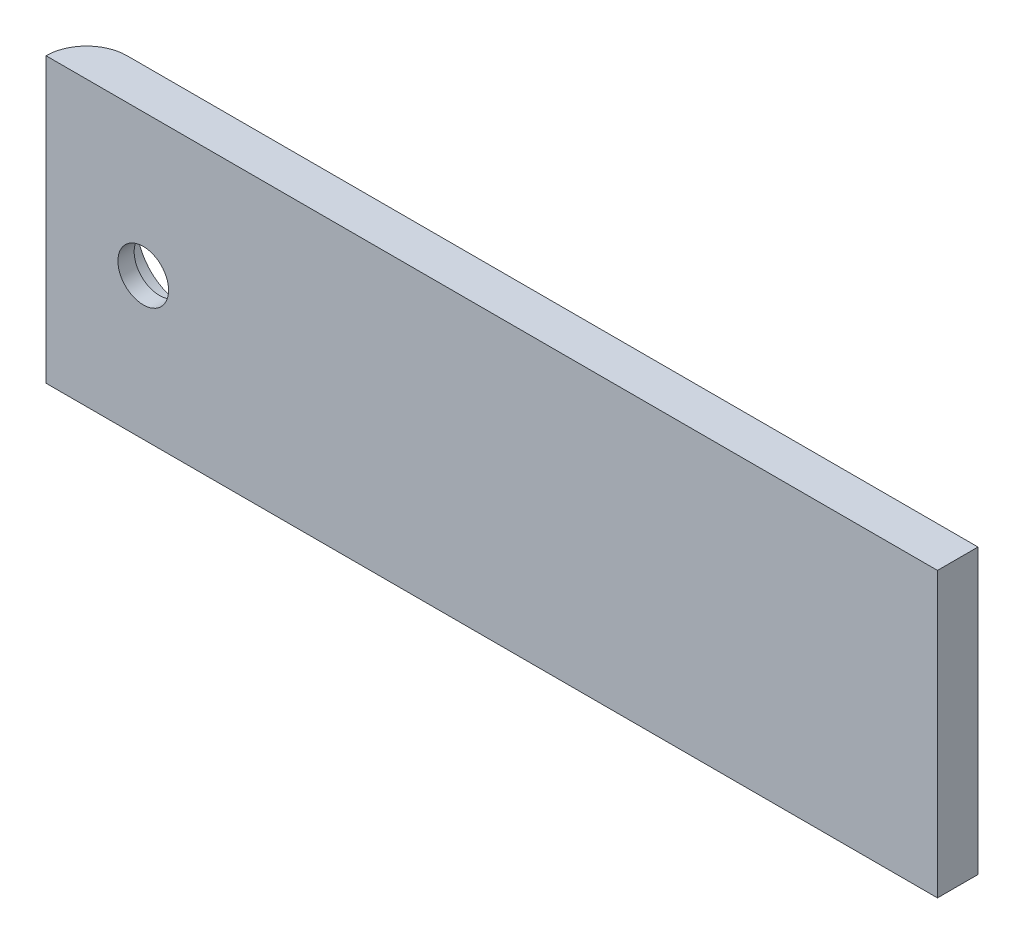
from build123d import *

# Parameters (mm, degrees)
SKETCH1_W           = 139.7
SKETCH1_H           = 6.35
BOSS_EXTRUDE1_DEPTH = 44.45
FILLET1_R           = 6.35
SKETCH4_R           = 3.96875
CUT_EXTRUDE2_DEPTH  = 254
SKETCH6_R           = 7.332348418
CUT_EXTRUDE4_DEPTH  = 3.81


with BuildPart() as part:
    # Sketch1 → Boss-Extrude1 (new body)
    with BuildSketch(Plane(origin=(0, 0, 0), x_dir=(1, 0, 0), z_dir=(0, 1, 0))):
        with Locations((69.85, 3.175)):
            Rectangle(SKETCH1_W, SKETCH1_H)
    extrude(amount=BOSS_EXTRUDE1_DEPTH)

    # Fillet1
    fillet1_edges = [part.edges().sort_by_distance(p)[0] for p in [
        (0, 22.225, -6.35),
    ]]
    fillet(fillet1_edges, radius=FILLET1_R - 0.0001)  # a hair under: the kernel refuses the full size

    # Sketch4 → Cut-Extrude2 (cut)
    with BuildSketch(Plane(origin=(69.948790088, 1.415162488, 139.7), x_dir=(1, 0, 0), z_dir=(0, 0, 1))):
        with Locations((-54.708790088, 20.809837512)):
            Circle(SKETCH4_R)
    extrude(amount=-CUT_EXTRUDE2_DEPTH, mode=Mode.SUBTRACT)

    # Sketch6 → Cut-Extrude4 (cut)
    with BuildSketch(Plane(origin=(0, 0, -6.35), x_dir=(-1, 0, 0), z_dir=(0, 0, -1))):
        with Locations((-15.24, 22.225)):
            Circle(SKETCH6_R)
    extrude(amount=-CUT_EXTRUDE4_DEPTH, mode=Mode.SUBTRACT)


solid = part.part
